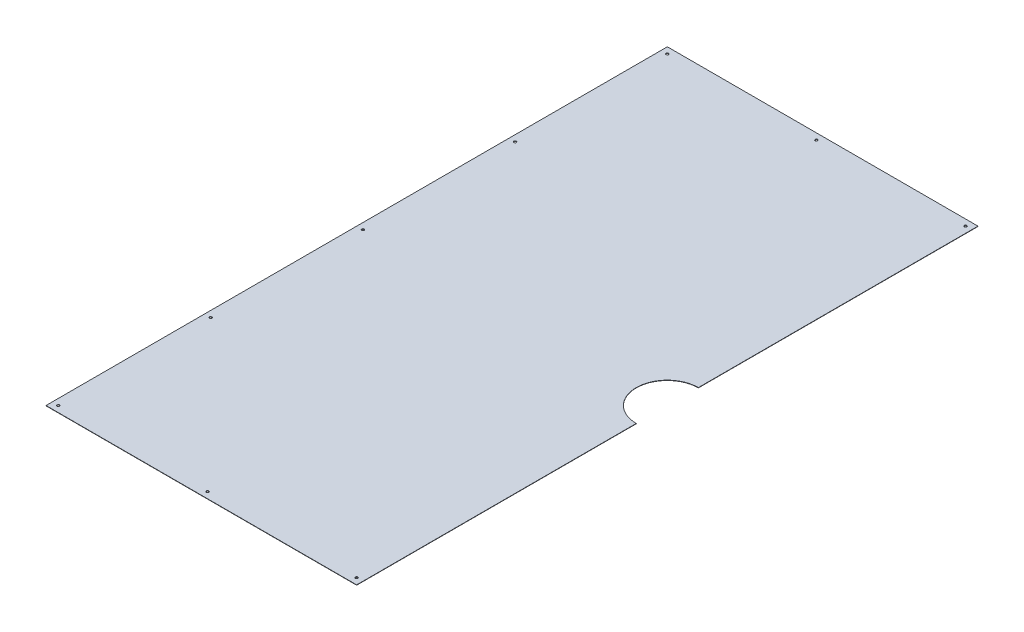
from build123d import *

# Parameters (mm, degrees)
SKETCH1_R           = 3
BOSS_EXTRUDE1_DEPTH = 1
CHAMFER1_SIZE       = 1


with BuildPart() as part:
    # Sketch1 → Boss-Extrude1 (new body)
    with BuildSketch(Plane(origin=(0, 0, 0), x_dir=(1, 0, 0), z_dir=(0, 1, 0))):
        with BuildLine():
            Line((-500, -1000), (500, -1000))
            Line((500, -1000), (500, -100))
            ThreePointArc((500, -100), (400, 0), (500, 100))
            Line((500, 100), (500, 1000))
            Line((500, 1000), (-500, 1000))
            Line((-500, 1000), (-500, -1000))
        make_face()
        with Locations(Location((-480, 490, 0), (0, 0, 270))):
            Circle(SKETCH1_R, mode=Mode.SUBTRACT)
        with Locations(Location((-480, -980, 0), (0, 0, 270))):
            Circle(SKETCH1_R, mode=Mode.SUBTRACT)
        with Locations(Location((480, -980, 0), (0, 0, 270))):
            Circle(SKETCH1_R, mode=Mode.SUBTRACT)
        with Locations(Location((480, 980, 0), (0, 0, 270))):
            Circle(SKETCH1_R, mode=Mode.SUBTRACT)
        with Locations(Location((-480, 980, 0), (0, 0, 270))):
            Circle(SKETCH1_R, mode=Mode.SUBTRACT)
        with Locations(Location((-480, 0, 0), (0, 0, 270))):
            Circle(SKETCH1_R, mode=Mode.SUBTRACT)
        with Locations(Location((-480, -490, 0), (0, 0, 270))):
            Circle(SKETCH1_R, mode=Mode.SUBTRACT)
        with Locations(Location((0, -980, 0), (0, 0, 270))):
            Circle(SKETCH1_R, mode=Mode.SUBTRACT)
        with Locations(Location((0, 980, 0), (0, 0, 270))):
            Circle(SKETCH1_R, mode=Mode.SUBTRACT)
    extrude(amount=BOSS_EXTRUDE1_DEPTH)

    # Chamfer1
    chamfer1_edges = [part.edges().sort_by_distance(p)[0] for p in [
        (0, 1, -983),
        (0, 1, 977),
        (-480, 1, 487),
        (-480, 1, -3),
        (-480, 1, -983),
        (480, 1, -983),
        (480, 1, 977),
        (-480, 1, 977),
        (-480, 1, -493),
    ]]
    chamfer(chamfer1_edges, length=CHAMFER1_SIZE - 0.0001)  # a hair under: the kernel refuses the full size


solid = part.part
